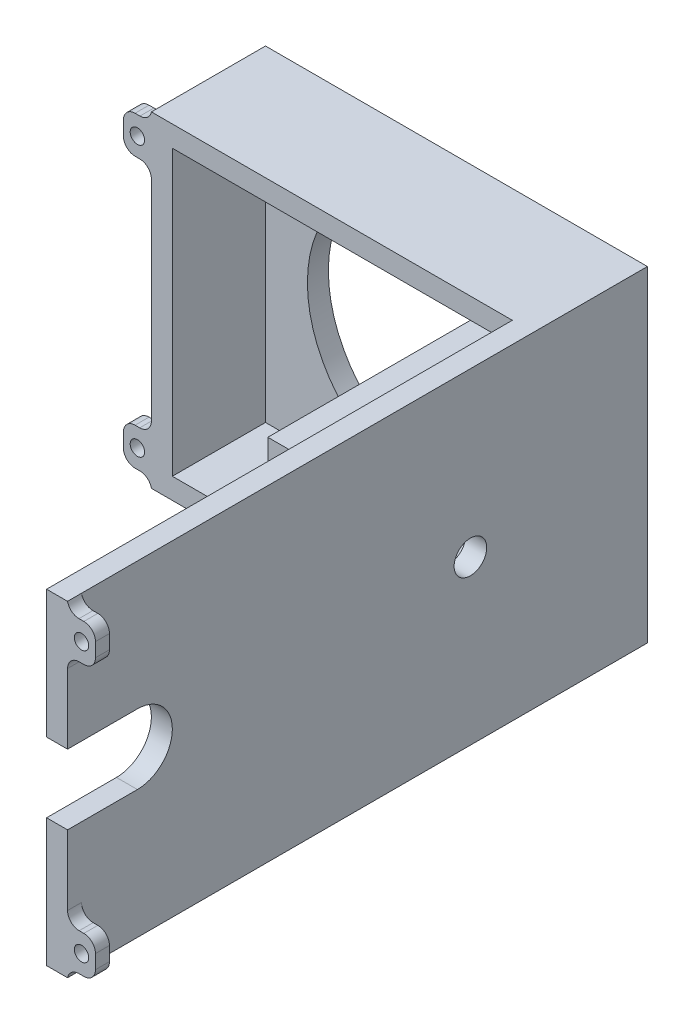
from build123d import *

# Parameters (mm, degrees)
SKETCH1_W               = 70
SKETCH1_H               = 82
BOSS_EXTRUDE1_DEPTH     = 4.5
SKETCH2_W               = 4.5
SKETCH2_H               = 70
BOSS_EXTRUDE2_DEPTH     = 120
BOSS_EXTRUDE3_DEPTH     = 20
CUT_EXTRUDE1_REACH      = 137.67
SKETCH4_R               = 27.5
CUT_EXTRUDE2_REACH      = 152.77
SKETCH5_R               = 3.5
SKETCH6_W               = 6
SKETCH6_H               = 8
BOSS_EXTRUDE4_DEPTH     = 3
SKETCH7_W               = 6
SKETCH7_H               = 8
BOSS_EXTRUDE5_DEPTH     = 3
CUT_EXTRUDE4_DEPTH      = 116.905133622
CUT_EXTRUDE4_DEPTH_BACK = 116.905133622
SKETCH8_R               = 1.55
FILLET1_R               = 2.5
SKETCH9_W               = 30.5
SKETCH9_H               = 40.5
BOSS_EXTRUDE6_DEPTH     = 9


with BuildPart() as part:
    # Sketch1 → Boss-Extrude1 (new body)
    with BuildSketch(Plane(origin=(0, 0, 0), x_dir=(0, 1, 0), z_dir=(0, 0, 1))):
        Rectangle(SKETCH1_W, SKETCH1_H)
    extrude(amount=BOSS_EXTRUDE1_DEPTH)

    # Sketch2 → Boss-Extrude2 (add)
    with BuildSketch(Plane.XY.offset(4.5)):
        with Locations((38.75, 0)):
            Rectangle(SKETCH2_W, SKETCH2_H)
    extrude(amount=BOSS_EXTRUDE2_DEPTH)

    # Sketch3 → Boss-Extrude3 (add)
    with BuildSketch(Plane.XY.offset(4.5)):
        Polygon((36.5, 35), (-41, 35), (-41, -35), (36.5, -35), (36.5, -30.5), (-36.5, -30.5), (-36.5, 30.5), (36.5, 30.5), align=None)
    extrude(amount=BOSS_EXTRUDE3_DEPTH)

    # Sketch4 → Cut-Extrude1 (cut, up to next)
    with BuildSketch(Plane(origin=(0, 0, 0), x_dir=(1, 0, 0), z_dir=(0, 0, -1)), mode=Mode.PRIVATE) as cut_extrude1_sk1:
        with Locations(Location((0, 0, 0), (0, 0, 180))):
            Circle(SKETCH4_R)
    cut_extrude1_tool1 = extrude(cut_extrude1_sk1.sketch, amount=-CUT_EXTRUDE1_REACH, mode=Mode.PRIVATE) & part.part
    add(cut_extrude1_tool1.solids().sort_by_distance((0, 0, 0))[0], mode=Mode.SUBTRACT)

    # Sketch5 → Cut-Extrude2 (cut, up to next)
    with BuildSketch(Plane(origin=(36.5, 0, 0), x_dir=(0, -1, 0), z_dir=(-1, 0, 0)), mode=Mode.PRIVATE) as cut_extrude2_sk1:
        with Locations((0, 38)):
            Circle(SKETCH5_R)
    cut_extrude2_tool1 = extrude(cut_extrude2_sk1.sketch, amount=-CUT_EXTRUDE2_REACH, mode=Mode.PRIVATE) & part.part
    # Sketch5 → Cut-Extrude2 (cut, up to next)
    with BuildSketch(Plane(origin=(36.5, 0, 0), x_dir=(0, -1, 0), z_dir=(-1, 0, 0)), mode=Mode.PRIVATE) as cut_extrude2_sk2:
        with BuildLine():
            Line((-7.5, 124.5), (7.5, 124.5))
            Line((7.5, 124.5), (7.5, 109.5))
            ThreePointArc((7.5, 109.5), (0, 102), (-7.5, 109.5))
            Line((-7.5, 109.5), (-7.5, 124.5))
        make_face()
    cut_extrude2_tool2 = extrude(cut_extrude2_sk2.sketch, amount=-CUT_EXTRUDE2_REACH, mode=Mode.PRIVATE) & part.part
    add(cut_extrude2_tool1.solids().sort_by_distance((36.5, 0, 38))[0], mode=Mode.SUBTRACT)
    add(cut_extrude2_tool2.solids().sort_by_distance((36.5, 0, 113.987689))[0], mode=Mode.SUBTRACT)

    # Sketch6 → Boss-Extrude4 (add)
    with BuildSketch(Plane.XY.offset(124.5)):
        with Locations((44, 29)):
            Rectangle(SKETCH6_W, SKETCH6_H)
        with Locations((44, -29)):
            Rectangle(SKETCH6_W, SKETCH6_H)
    extrude(amount=-BOSS_EXTRUDE4_DEPTH)

    # Sketch7 → Boss-Extrude5 (add)
    with BuildSketch(Plane.XY.offset(24.5)):
        with Locations((-44, -29)):
            Rectangle(SKETCH7_W, SKETCH7_H)
        with Locations((-44, 29)):
            Rectangle(SKETCH7_W, SKETCH7_H)
    extrude(amount=-BOSS_EXTRUDE5_DEPTH)

    # Sketch8 → Cut-Extrude4 (cut, two sides: drawn at the far end of the back side and taken through both)
    with BuildSketch(Plane.XY.offset(24.5).offset(-CUT_EXTRUDE4_DEPTH_BACK)):
        with Locations((-44, 29)):
            Circle(SKETCH8_R)
        with Locations((44, 29)):
            Circle(SKETCH8_R)
        with Locations((44, -29)):
            Circle(SKETCH8_R)
        with Locations((-44, -29)):
            Circle(SKETCH8_R)
    extrude(amount=CUT_EXTRUDE4_DEPTH + CUT_EXTRUDE4_DEPTH_BACK, mode=Mode.SUBTRACT)

    # Fillet1
    # the kernel refuses this fillet: 2.5 mm, written as the material it adds along each edge
    with BuildSketch(Plane(origin=(-41, 33, 24.5), x_dir=(-1.5774048733869181e-12, 1.0, 0), z_dir=(0, 0, -1)), Plane(origin=(41, -33, 124.5), x_dir=(1.5312195955625318e-12, -1.0, 0), z_dir=(0, 0, -1))) as fillet1_piece_1:
        with BuildLine():
            CenterArc((2.5, -2.449489743), FILLET1_R, 101.536959033, 78.463040967)
            Line((0, -2.449489743), (0, 0))
            Line((0, 0), (2, 0))
        make_face()
    extrude(amount=3)
    with BuildSketch(Plane(origin=(-41, 25, 24.5), x_dir=(0, -1, 0), z_dir=(0, 0, -1)), Plane(origin=(41, -25, 124.5), x_dir=(0, 1, 0), z_dir=(0, 0, -1))) as fillet1_piece_2:
        with BuildLine():
            CenterArc((FILLET1_R, FILLET1_R), FILLET1_R, 180, 90)
            Line((0, FILLET1_R), (0, 0))
            Line((0, 0), (FILLET1_R, 0))
        make_face()
    extrude(amount=3)
    with BuildSketch(Plane(origin=(-41, -25, 24.5), x_dir=(0, 1, 0), z_dir=(0, 0, -1)), Plane(origin=(41, 25, 124.5), x_dir=(0, -1, 0), z_dir=(0, 0, -1))) as fillet1_piece_3:
        with BuildLine():
            CenterArc((FILLET1_R, -FILLET1_R), FILLET1_R, 90, 90)
            Line((0, -FILLET1_R), (0, 0))
            Line((0, 0), (FILLET1_R, 0))
        make_face()
    extrude(amount=3)
    with BuildSketch(Plane(origin=(-41, -33, 24.5), x_dir=(-1.6022738691384966e-12, -1.0, 0), z_dir=(0, 0, -1)), Plane(origin=(41, 33, 124.5), x_dir=(1.4885870314169656e-12, 1.0, 0), z_dir=(0, 0, -1))) as fillet1_piece_4:
        with BuildLine():
            CenterArc((2.5, 2.449489743), FILLET1_R, 180, 78.463040967)
            Line((0, 2.449489743), (0, 0))
            Line((0, 0), (2, 0))
        make_face()
    extrude(amount=3)
    # the kernel refuses this fillet: 2.5 mm, written as the material it takes off along each edge
    with BuildSketch(Plane(origin=(-47, 25, 30.75), x_dir=(1, 0, 0), z_dir=(0, 0, -1)), Plane(origin=(-47, 33, 30.75), x_dir=(0, -1, 0), z_dir=(0, 0, -1)), Plane(origin=(-47, -33, 30.75), x_dir=(1, 0, 0), z_dir=(0, 0, -1)), Plane(origin=(-47, -25, 30.75), x_dir=(0, -1, 0), z_dir=(0, 0, -1)), Plane(origin=(47, 33, 130.75), x_dir=(-1, 0, 0), z_dir=(0, 0, -1)), Plane(origin=(47, 25, 130.75), x_dir=(0, 1, 0), z_dir=(0, 0, -1))) as fillet1_2_piece_1:
        with BuildLine():
            CenterArc((FILLET1_R, -FILLET1_R), FILLET1_R, 90, 90)
            Line((0, -FILLET1_R), (0, 0))
            Line((0, 0), (FILLET1_R, 0))
        make_face()
    extrude(amount=15.5, mode=Mode.SUBTRACT)
    with BuildSketch(Plane(origin=(47, -25, 130.75), x_dir=(0, -1, 0), z_dir=(0, 0, -1)), Plane(origin=(47, -33, 130.75), x_dir=(-1, 0, 0), z_dir=(0, 0, -1))) as fillet1_2_piece_2:
        with BuildLine():
            CenterArc((FILLET1_R, FILLET1_R), FILLET1_R, 180, 90)
            Line((0, FILLET1_R), (0, 0))
            Line((0, 0), (FILLET1_R, 0))
        make_face()
    extrude(amount=15.5, mode=Mode.SUBTRACT)

    # Sketch9 → Boss-Extrude6 (add)
    with BuildSketch(Plane(origin=(36.5, 0, 0), x_dir=(0, -1, 0), z_dir=(-1, 0, 0))):
        Polygon((-30.5, 24.5), (-30.5, 68), (30.5, 68), (30.5, 24.5), (30.5, 4.5), (-30.5, 4.5), align=None)
        with Locations((0, 38)):
            Rectangle(SKETCH9_W, SKETCH9_H, mode=Mode.SUBTRACT)
    extrude(amount=BOSS_EXTRUDE6_DEPTH)


solid = part.part
